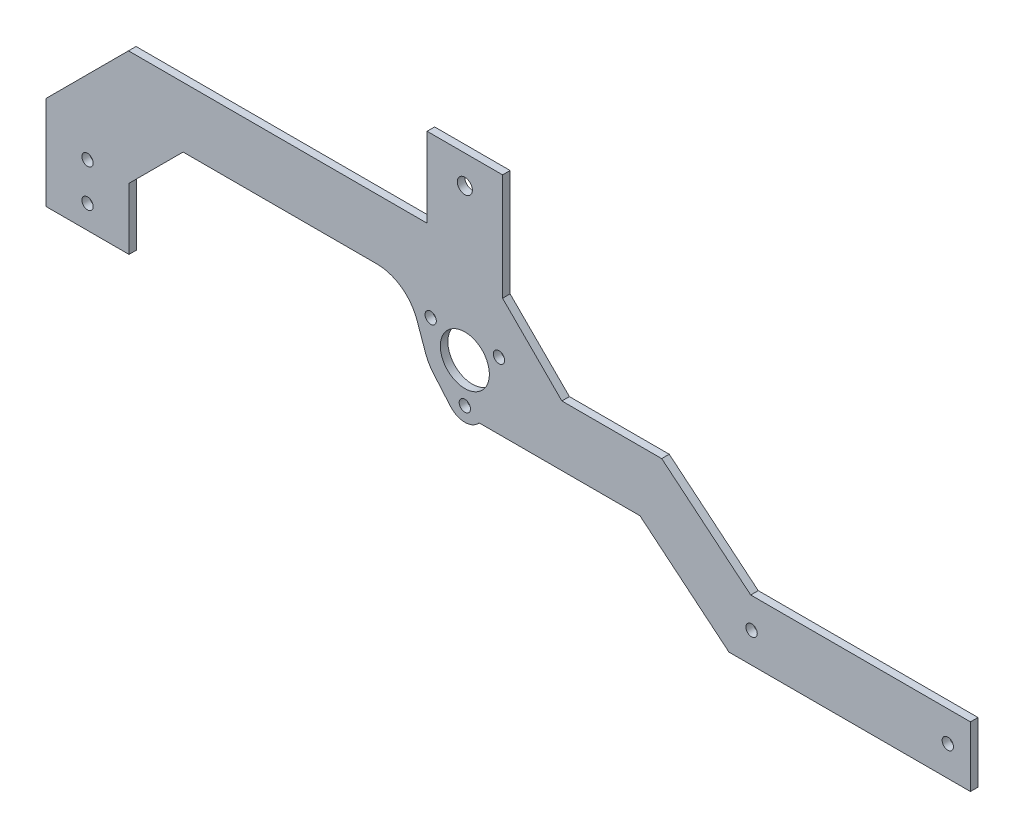
from build123d import *

# Parameters (mm, degrees)
SKETCH_1_R         = 1.5
SKETCH_1_R_2       = 6.5
SKETCH_1_R_3       = 2
EXTRUDE_4207_DEPTH = 2


with BuildPart() as part:
    # Sketch 1 → Extrude 4207 (new body)
    with BuildSketch(Plane.XY):
        with BuildLine():
            Line((52.173287391, 3.506756757), (75.759174655, -16))
            Line((75.759174655, -16), (134, -16))
            Line((134, -16), (134, -32))
            Line((134, -32), (70, -32))
            Line((70, -32), (46.414112736, -12.493243243))
            Line((46.414112736, -12.493243243), (3.805439957, -12.493243243))
            ThreePointArc((3.805439957, -12.493243243), (0, -14.25), (-3.805439957, -12.493243243))
            Line((-3.805439957, -12.493243243), (-8.371967905, -7.135135135))
            ThreePointArc((-8.371967905, -7.135135135), (-9.526279442, -5.5), (-10.365192239, -3.682769318))
            Line((-10.365192239, -3.682769318), (-12.722186003, 2.951013946))
            ThreePointArc((-12.722186003, 2.951013946), (-16.838795699, 8.380317084), (-23.333004301, 10.441642526))
            Line((-23.333004301, 10.441642526), (-74.6645549, 10.441642526))
            Line((-74.6645549, 10.441642526), (-89, -3.893802574))
            Line((-89, -3.893802574), (-89, -20.224368594))
            Line((-89, -20.224368594), (-111, -20.224368594))
            Line((-111, -20.224368594), (-111, 4.582218771))
            Line((-111, 4.582218771), (-89.140576245, 26.441642526))
            Line((-89.140576245, 26.441642526), (-10, 26.441642526))
            Line((-10, 26.441642526), (-10, 47.546378015))
            Line((-10, 47.546378015), (10, 47.546378015))
            Line((10, 47.546378015), (10, 19.222746242))
            Line((10, 19.222746242), (25.715989485, 3.506756757))
            Line((25.715989485, 3.506756757), (52.173287391, 3.506756757))
        make_face()
        with Locations((-100, -14)):
            Circle(SKETCH_1_R, mode=Mode.SUBTRACT)
        with Locations((-100, -4)):
            Circle(SKETCH_1_R, mode=Mode.SUBTRACT)
        Circle(SKETCH_1_R_2, mode=Mode.SUBTRACT)
        with Locations((0, -10.45)):
            Circle(SKETCH_1_R, mode=Mode.SUBTRACT)
        with Locations((-9.04996547, 5.225)):
            Circle(SKETCH_1_R, mode=Mode.SUBTRACT)
        with Locations((9.04996547, 5.225)):
            Circle(SKETCH_1_R, mode=Mode.SUBTRACT)
        with Locations((128, -24)):
            Circle(SKETCH_1_R, mode=Mode.SUBTRACT)
        with Locations((76, -24)):
            Circle(SKETCH_1_R, mode=Mode.SUBTRACT)
        with Locations((0, 40)):
            Circle(SKETCH_1_R_3, mode=Mode.SUBTRACT)
    extrude(amount=EXTRUDE_4207_DEPTH)


solid = part.part
